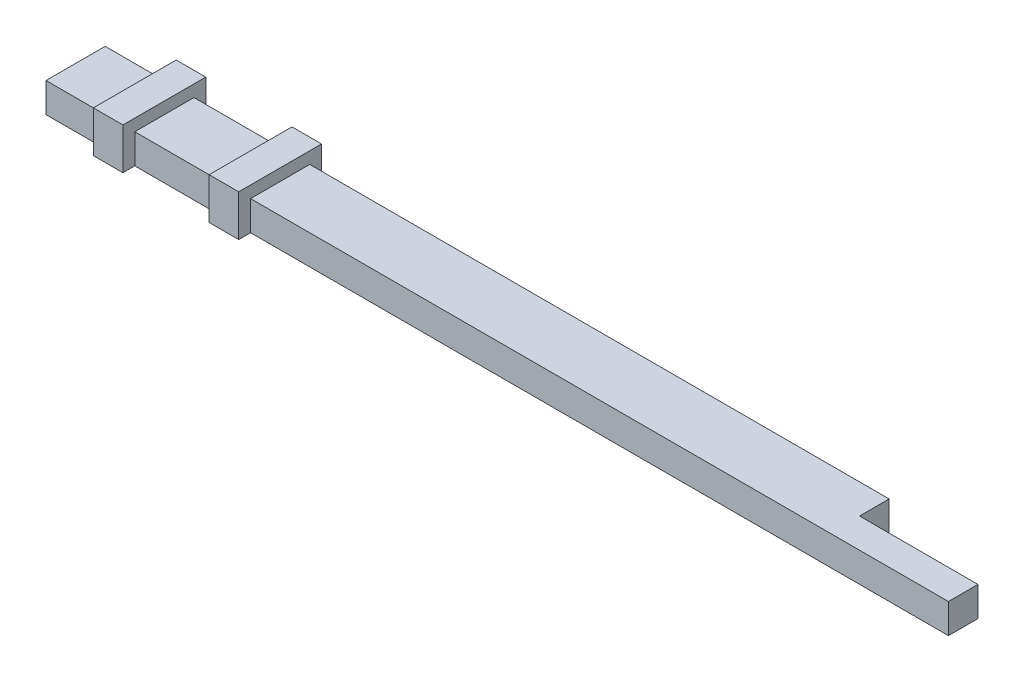
from build123d import *

# Parameters (mm, degrees)
BOSS_EXTRUDE1_DEPTH = 5
SKETCH2_W           = 14
SKETCH2_H           = 7
BOSS_EXTRUDE2_DEPTH = 5
SKETCH3_W           = 14
SKETCH3_H           = 7
BOSS_EXTRUDE3_DEPTH = 5


with BuildPart() as part:
    # Sketch1 → Boss-Extrude1 (new body)
    with BuildSketch(Plane(origin=(0, 0, 0), x_dir=(1, 0, 0), z_dir=(0, 1, 0))):
        Polygon((132.481495242, 10), (132.481495242, 5), (142.481495242, 5), (152.5, 5), (152.5, 0), (142.5, 0), (0, 0), (0, 10), align=None)
    extrude(amount=BOSS_EXTRUDE1_DEPTH)

    # Sketch2 → Boss-Extrude2 (add)
    with BuildSketch(Plane.ZY.offset(-10)):
        with Locations((-5, 3.5)):
            Rectangle(SKETCH2_W, SKETCH2_H)
    extrude(amount=-BOSS_EXTRUDE2_DEPTH)

    # Sketch3 → Boss-Extrude3 (add)
    with BuildSketch(Plane(origin=(34.57, 0, 0), x_dir=(0, 0, -1), z_dir=(1, 0, 0))):
        with Locations((5, 3.5)):
            Rectangle(SKETCH3_W, SKETCH3_H)
    extrude(amount=-BOSS_EXTRUDE3_DEPTH)


solid = part.part
